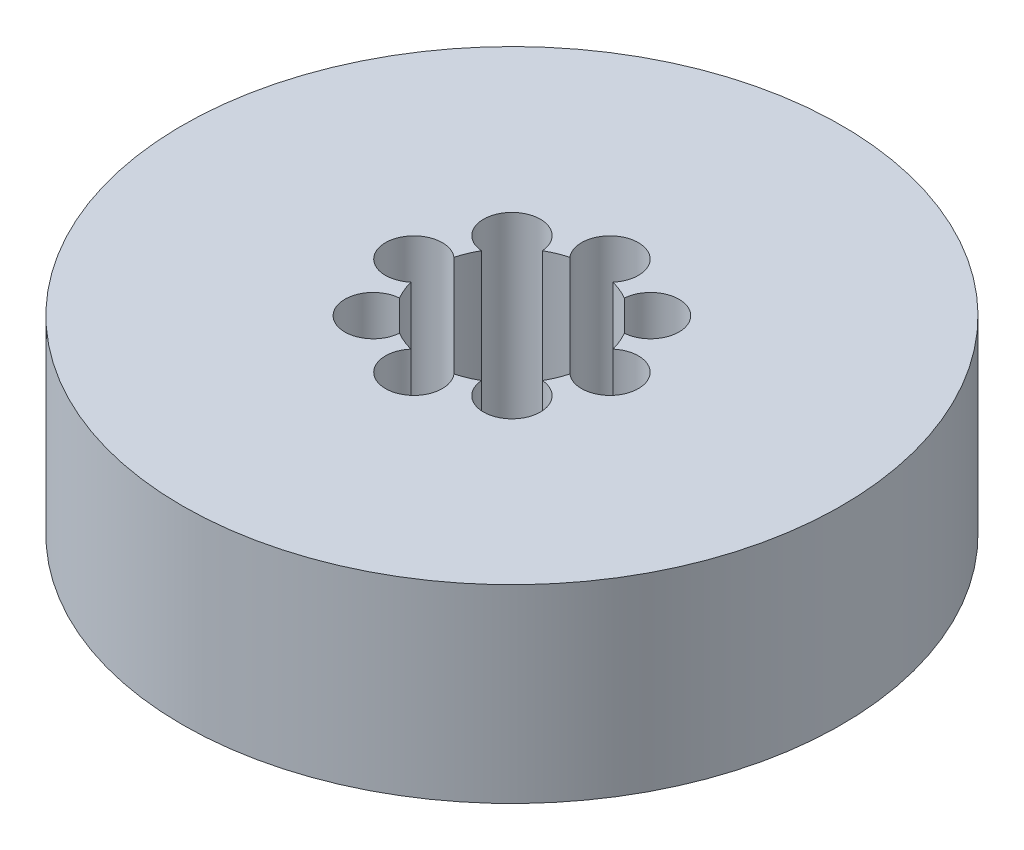
from build123d import *

# Parameters (mm, degrees)
SKETCH1_R           = 40
BOSS_EXTRUDE1_DEPTH = 23
SKETCH2_R           = 10
CUT_EXTRUDE1_DEPTH  = 62.065538563
SKETCH3_R           = 3.450480334
CUT_EXTRUDE2_DEPTH  = 22.275773443
CIRPATTERN1_COUNT   = 8


with BuildPart() as part:
    # Sketch1 → Boss-Extrude1 (new body)
    with BuildSketch(Plane(origin=(0, 0, 0), x_dir=(1, 0, 0), z_dir=(0, 1, 0))):
        Circle(SKETCH1_R)
    extrude(amount=BOSS_EXTRUDE1_DEPTH)

    # Sketch2 → Cut-Extrude1 (cut, through all)
    with BuildSketch(Plane(origin=(0, 0, 0), x_dir=(1, 0, 0), z_dir=(0, 1, 0))):
        Circle(SKETCH2_R)
    extrude(amount=CUT_EXTRUDE1_DEPTH, mode=Mode.SUBTRACT)

    # Sketch3 → Cut-Extrude2 (cut)
    with BuildSketch(Plane(origin=(0, 23, 0), x_dir=(1, 0, 0), z_dir=(0, 1, 0))):
        with Locations((-11.898753027, 0)):
            Circle(SKETCH3_R)
    cut_extrude2 = extrude(amount=-CUT_EXTRUDE2_DEPTH, mode=Mode.SUBTRACT)

    # CirPattern1: Cut-Extrude2 ×8 about axis
    cirpattern1_axis = Axis((0, 0, 0), (0, 1, 0))
    for i in range(1, CIRPATTERN1_COUNT):
        add(cut_extrude2.rotate(cirpattern1_axis, i * 360 / CIRPATTERN1_COUNT), mode=Mode.SUBTRACT)


solid = part.part
